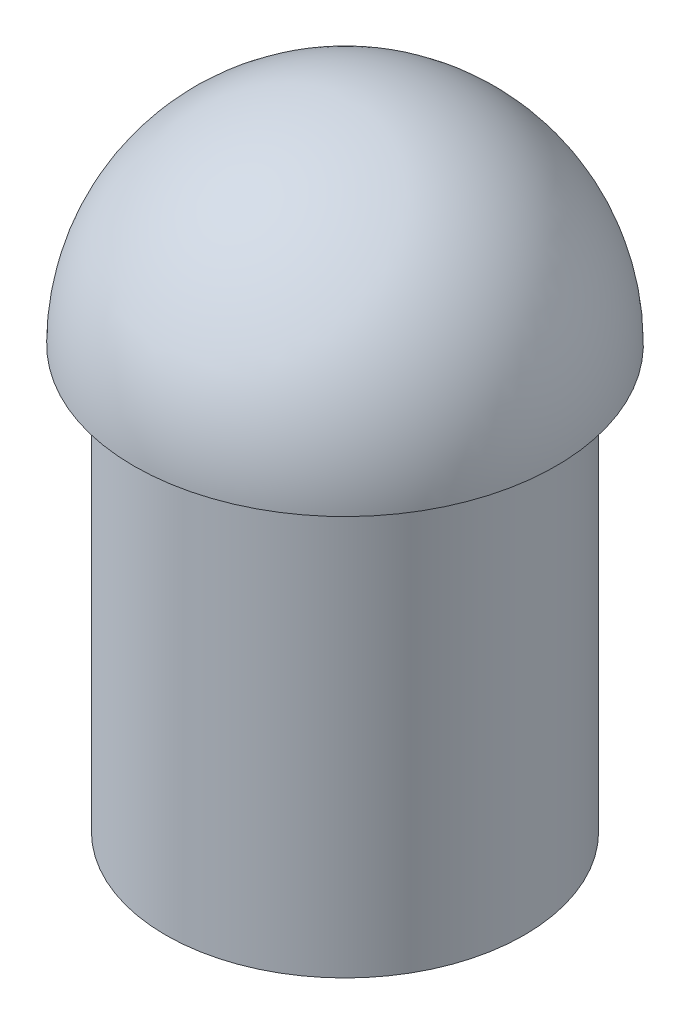
from build123d import *

# Parameters (mm, degrees)
SKETCH3_R           = 2.125
BOSS_EXTRUDE1_DEPTH = 5
SKETCH4_W           = 2.85
SKETCH4_H           = 2.85
CUT_EXTRUDE1_DEPTH  = 2


with BuildPart() as part:
    # Sketch1 → Revolve5 (revolve)
    with BuildSketch(Plane(origin=(0, 0, 0), x_dir=(0, 0, -1), z_dir=(1, 0, 0))):
        with BuildLine():
            Line((0, 2.5), (0, 0))
            Line((0, 0), (2.5, 0))
            ThreePointArc((2.5, 0), (1.767766953, 1.767766953), (0, 2.5))
        make_face()
    revolve(axis=Axis((0, 0, 0), (0, 1, 0)))

    # Sketch3 → Boss-Extrude1 (add)
    with BuildSketch(Plane.XZ):
        Circle(SKETCH3_R)
    extrude(amount=BOSS_EXTRUDE1_DEPTH)

    # Sketch4 → Cut-Extrude1 (cut)
    with BuildSketch(Plane.XZ.offset(5)):
        Rectangle(SKETCH4_W, SKETCH4_H)
    extrude(amount=-CUT_EXTRUDE1_DEPTH, mode=Mode.SUBTRACT)


solid = part.part
